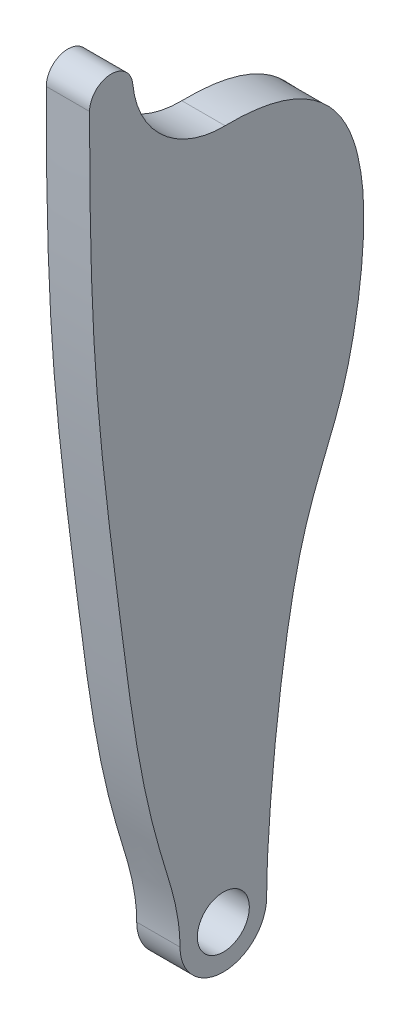
from build123d import *

# Parameters (mm, degrees)
SKETCH1_R               = 6
BOSS_EXTRUDE1_DEPTH     = 10
CUT_EXTRUDE1_DEPTH      = 194.005127554
CUT_EXTRUDE1_DEPTH_BACK = 194.005127554


with BuildPart() as part:
    # Sketch1 → Boss-Extrude1 (new body)
    with BuildSketch(Plane(origin=(0, 0, 0), x_dir=(0, 0, -1), z_dir=(1, 0, 0))):
        with BuildLine():
            ThreePointArc((17.152768162, -12.115384615), (-5.385032092, -20.29781834), (-20.902696168, -2.019230769))
            ThreePointArc((-20.902696168, -2.019230769), (-26.120192146, 2.494204747), (-30.879528589, -2.5))
            add(Edge.make_bspline(
                [(-30.879528589, -2.5), (-30.879528589, -21.713795822), (-30.397498214, -56.718442889), (-23.623794361, -108.94591197), (-18.331443435, -149.970304884), (-10, -172.340467578), (-10, -180)],
                knots=[0, 0, 0, 0, 0.30844516, 0.604189988, 0.874787953, 1, 1, 1, 1], degree=3))
            ThreePointArc((-10, -180), (0, -190), (10, -180))
            add(Edge.make_bspline(
                [(26.236760582, -15), (26.236760582, -30.845701064), (35.459548908, -43.562493342), (29.157858427, -90.429448691), (15.335031389, -110.84026221), (10, -165.45650348), (10, -180)],
                knots=[0, 0, 0, 0, 0.187609719, 0.382215489, 0.5597669, 0.781850651, 0.781850651, 0.781850651, 0.781850651], degree=3))
            ThreePointArc((26.236760582, -15), (22.750041438, -10.234500965), (17.152768162, -12.115384615))
        make_face()
        with Locations((0, -180)):
            Circle(SKETCH1_R, mode=Mode.SUBTRACT)
    extrude(amount=BOSS_EXTRUDE1_DEPTH)

    # Sketch2 → Cut-Extrude1 (cut, two sides: drawn at the far end of the back side and taken through both)
    with BuildSketch(Plane(origin=(10, 0, 0), x_dir=(0, 0, -1), z_dir=(1, 0, 0)).offset(-CUT_EXTRUDE1_DEPTH_BACK)):
        with BuildLine():
            ThreePointArc((26.236760582, -15), (22.750041438, -10.234500965), (17.152768162, -12.115384615))
            ThreePointArc((17.152768162, -12.115384615), (9.838889304, -18.552526978), (0.407091899, -20.996053824))
            add(Edge.make_bspline(
                [(0.407091899, -20.996053824), (17.387590291, -20.666819417), (27.718983869, -27.869761333), (31.022534939, -42.231394819)],
                knots=[0, 0, 0, 0, 1, 1, 1, 1], degree=3))
            add(Edge.make_bspline(
                [(26.236760582, -15), (26.236760582, -27.865850369), (29.221204122, -34.400411602), (31.022534939, -42.231394819)],
                knots=[0, 0, 0, 0, 0.152328923, 0.152328923, 0.152328923, 0.152328923], degree=3))
        make_face()
    extrude(amount=CUT_EXTRUDE1_DEPTH + CUT_EXTRUDE1_DEPTH_BACK, mode=Mode.SUBTRACT)


solid = part.part
